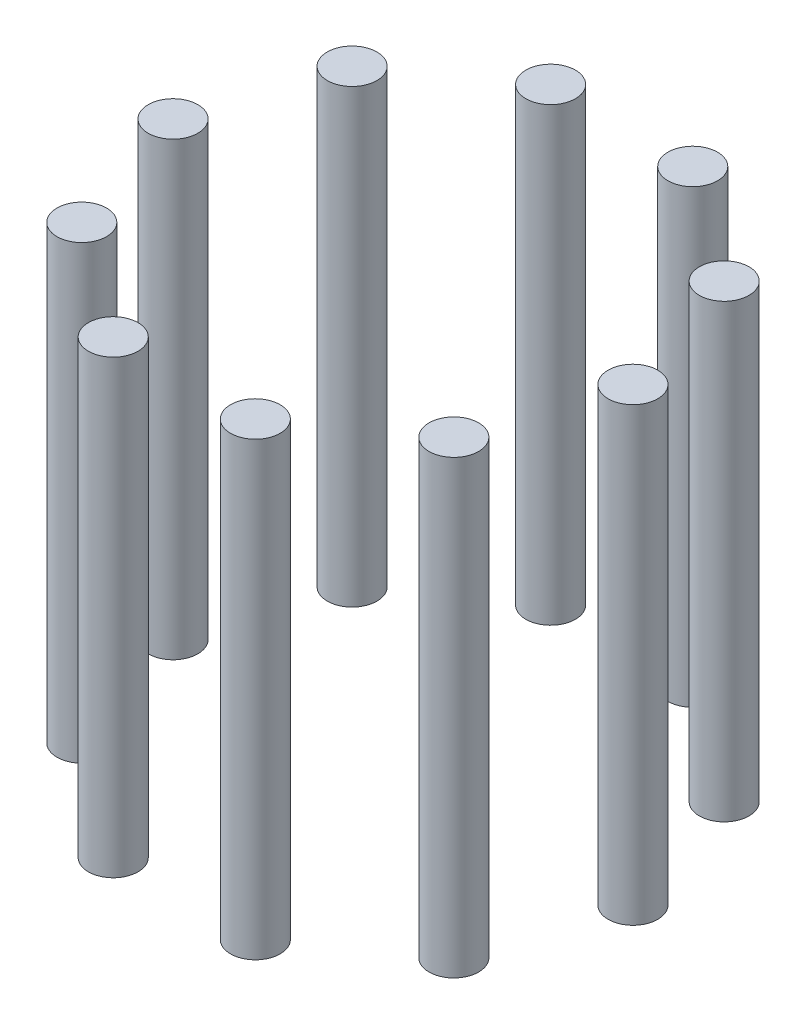
from build123d import *

# Parameters (mm, degrees)
SKETCH1_R              = 5.5
BOSS_EXTRUDE1_DEPTH    = 100
BOSS_EXTRUDE1_2_DEPTH  = 100
BOSS_EXTRUDE1_3_DEPTH  = 100
BOSS_EXTRUDE1_4_DEPTH  = 100
BOSS_EXTRUDE1_5_DEPTH  = 100
BOSS_EXTRUDE1_6_DEPTH  = 100
BOSS_EXTRUDE1_7_DEPTH  = 100
BOSS_EXTRUDE1_8_DEPTH  = 100
BOSS_EXTRUDE1_9_DEPTH  = 100
BOSS_EXTRUDE1_10_DEPTH = 100


with BuildPart() as part:
    # Sketch1 → Boss-Extrude1 (new body)
    with BuildSketch(Plane(origin=(0, 0, 0), x_dir=(1, 0, 0), z_dir=(0, 1, 0))):
        with Locations((51, 0)):
            Circle(SKETCH1_R)
    extrude(amount=BOSS_EXTRUDE1_DEPTH)


with BuildPart() as body_2:
    # Sketch1 → Boss-Extrude1 2 (new body)
    with BuildSketch(Plane(origin=(0, 0, 0), x_dir=(1, 0, 0), z_dir=(0, 1, 0))):
        with Locations((41.259866713, -29.977047867)):
            Circle(SKETCH1_R)
    extrude(amount=BOSS_EXTRUDE1_2_DEPTH)


with BuildPart() as body_3:
    # Sketch1 → Boss-Extrude1 3 (new body)
    with BuildSketch(Plane(origin=(0, 0, 0), x_dir=(1, 0, 0), z_dir=(0, 1, 0))):
        with Locations((15.759866713, -48.503882331)):
            Circle(SKETCH1_R)
    extrude(amount=BOSS_EXTRUDE1_3_DEPTH)


with BuildPart() as body_4:
    # Sketch1 → Boss-Extrude1 4 (new body)
    with BuildSketch(Plane(origin=(0, 0, 0), x_dir=(1, 0, 0), z_dir=(0, 1, 0))):
        with Locations((-15.759866713, -48.503882331)):
            Circle(SKETCH1_R)
    extrude(amount=BOSS_EXTRUDE1_4_DEPTH)


with BuildPart() as body_5:
    # Sketch1 → Boss-Extrude1 5 (new body)
    with BuildSketch(Plane(origin=(0, 0, 0), x_dir=(1, 0, 0), z_dir=(0, 1, 0))):
        with Locations((-41.259866713, -29.977047867)):
            Circle(SKETCH1_R)
    extrude(amount=BOSS_EXTRUDE1_5_DEPTH)


with BuildPart() as body_6:
    # Sketch1 → Boss-Extrude1 6 (new body)
    with BuildSketch(Plane(origin=(0, 0, 0), x_dir=(1, 0, 0), z_dir=(0, 1, 0))):
        with Locations((-51, 0)):
            Circle(SKETCH1_R)
    extrude(amount=BOSS_EXTRUDE1_6_DEPTH)


with BuildPart() as body_7:
    # Sketch1 → Boss-Extrude1 7 (new body)
    with BuildSketch(Plane(origin=(0, 0, 0), x_dir=(1, 0, 0), z_dir=(0, 1, 0))):
        with Locations((-41.259866713, 29.977047867)):
            Circle(SKETCH1_R)
    extrude(amount=BOSS_EXTRUDE1_7_DEPTH)


with BuildPart() as body_8:
    # Sketch1 → Boss-Extrude1 8 (new body)
    with BuildSketch(Plane(origin=(0, 0, 0), x_dir=(1, 0, 0), z_dir=(0, 1, 0))):
        with Locations((-15.759866713, 48.503882331)):
            Circle(SKETCH1_R)
    extrude(amount=BOSS_EXTRUDE1_8_DEPTH)


with BuildPart() as body_9:
    # Sketch1 → Boss-Extrude1 9 (new body)
    with BuildSketch(Plane(origin=(0, 0, 0), x_dir=(1, 0, 0), z_dir=(0, 1, 0))):
        with Locations((15.759866713, 48.503882331)):
            Circle(SKETCH1_R)
    extrude(amount=BOSS_EXTRUDE1_9_DEPTH)


with BuildPart() as body_10:
    # Sketch1 → Boss-Extrude1 10 (new body)
    with BuildSketch(Plane(origin=(0, 0, 0), x_dir=(1, 0, 0), z_dir=(0, 1, 0))):
        with Locations((41.259866713, 29.977047867)):
            Circle(SKETCH1_R)
    extrude(amount=BOSS_EXTRUDE1_10_DEPTH)


solid = Compound([part.part, body_2.part, body_3.part, body_4.part, body_5.part, body_6.part, body_7.part, body_8.part, body_9.part, body_10.part])
